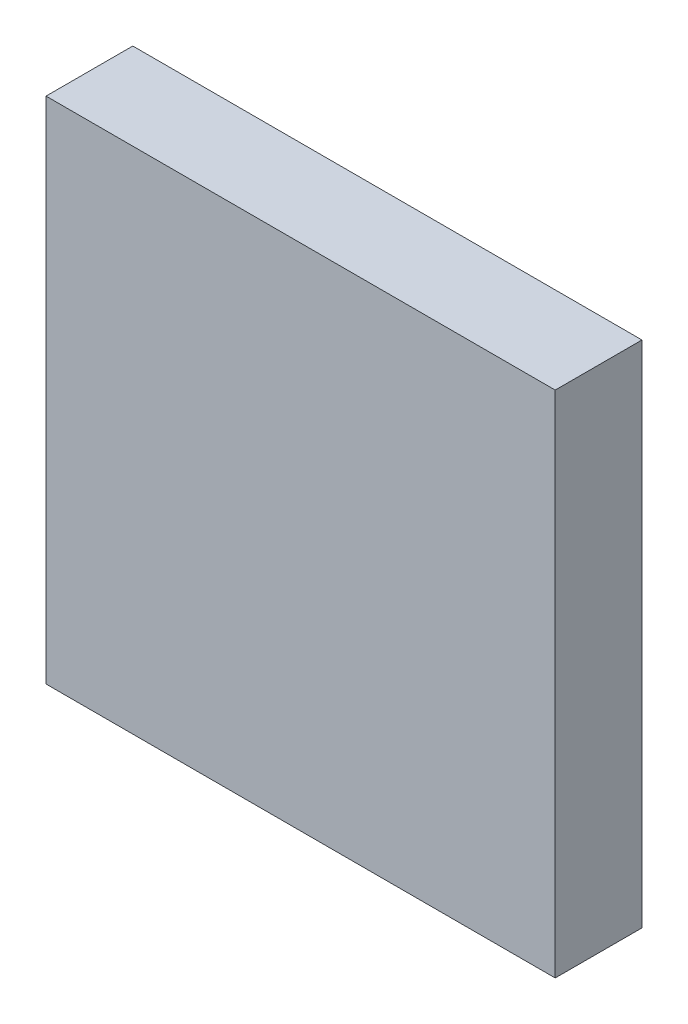
from build123d import *

# Parameters (mm, degrees)
SKIZZE1_W                       = 135
SKIZZE1_H                       = 135
SKIZZE1_W_2                     = 131
SKIZZE1_H_2                     = 131
AUFSATZ_LINEAR_AUSTRAGEN1_DEPTH = 18
SKIZZE2_W                       = 135
SKIZZE2_H                       = 135
AUFSATZ_LINEAR_AUSTRAGEN2_DEPTH = 5
SCHNITT_LINEAR_AUSTRAGEN1_DEPTH = 11


with BuildPart() as part:
    # Skizze1 → Aufsatz-Linear austragen1 (new body)
    with BuildSketch(Plane.XY):
        Rectangle(SKIZZE1_W, SKIZZE1_H)
        Rectangle(SKIZZE1_W_2, SKIZZE1_H_2, mode=Mode.SUBTRACT)
    extrude(amount=AUFSATZ_LINEAR_AUSTRAGEN1_DEPTH)

    # Skizze2 → Aufsatz-Linear austragen2 (add)
    with BuildSketch(Plane.XY.offset(18)):
        Rectangle(SKIZZE2_W, SKIZZE2_H)
    extrude(amount=AUFSATZ_LINEAR_AUSTRAGEN2_DEPTH)

    # Skizze3 → Schnitt-Linear austragen1 (cut)
    with BuildSketch(Plane.ZY.offset(67.5)):
        Polygon((5, -33.148996127), (3, -33.148996127), (3, -41.848996127), (5, -41.848996127), (7.4, -41.848996127), (7.4, -33.148996127), align=None)
    extrude(amount=-SCHNITT_LINEAR_AUSTRAGEN1_DEPTH, mode=Mode.SUBTRACT)


solid = part.part
